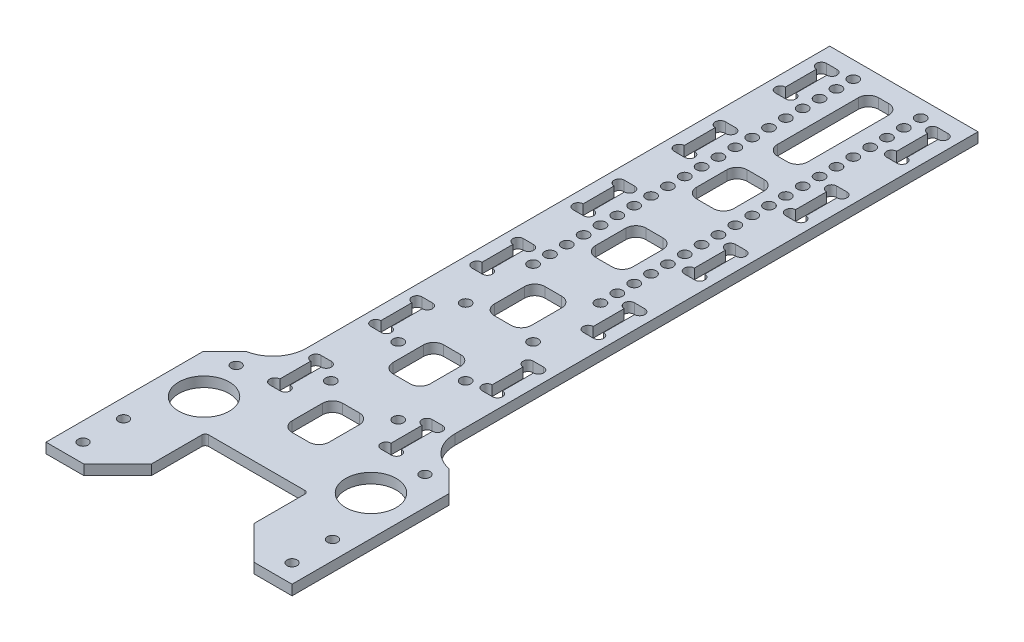
from build123d import *

# Parameters (mm, degrees)
SKETCH_1_W          = 80
SKETCH_1_H          = 225
EXTRUDE_1_DEPTH     = 3
SKETCH_2_W          = 30.5
SKETCH_2_H          = 33
CUT_EXTRUDE_1_DEPTH = 239.817922276
SKETCH_3_W          = 18
SKETCH_3_H          = 165
CUT_EXTRUDE_2_DEPTH = 3
CHAMFER_1_SIZE      = 10
FILLET_1_R          = 10
SKETCH_4_W          = 3.1
SKETCH_4_H          = 15.2
CUT_EXTRUDE_3_DEPTH = 239.817922276
SKETCH_6_R          = 1.55
CUT_EXTRUDE_4_DEPTH = 239.817922276
SKETCH_7_W          = 11
SKETCH_7_H          = 15
SKETCH_7_W_2        = 9
SKETCH_7_H_2        = 30
CUT_EXTRUDE_5_DEPTH = 3
FILLET_2_R          = 3
SKETCH_8_R          = 1.5
CUT_EXTRUDE_6_DEPTH = 45
SKETCH_9_R          = 7.5
CUT_EXTRUDE_7_DEPTH = 239.817922276
CHAMFER_2_SIZE      = 10
SKETCH_10_R         = 1.5
CUT_EXTRUDE_8_DEPTH = 10
SKETCH_12_R         = 1.5
CUT_EXTRUDE_9_DEPTH = 10
FILLET_3_R          = 1


with BuildPart() as part:
    # 草图1 → 凸台-拉伸1 (new body)
    with BuildSketch(Plane(origin=(0, 0, 0), x_dir=(1, 0, 0), z_dir=(0, 1, 0))):
        with Locations((40, 112.5)):
            Rectangle(SKETCH_1_W, SKETCH_1_H)
    extrude(amount=EXTRUDE_1_DEPTH)

    # 草图2 → 切除-拉伸1 (cut, through all)
    with BuildSketch(Plane(origin=(0, 3, 0), x_dir=(1, 0, 0), z_dir=(0, 1, 0))):
        with Locations((40, 16.5)):
            Rectangle(SKETCH_2_W, SKETCH_2_H)
    extrude(amount=-CUT_EXTRUDE_1_DEPTH, mode=Mode.SUBTRACT)

    # 草图3 → 切除-拉伸2 (cut)
    with BuildSketch(Plane.XZ):
        with Locations((71, -142.5)):
            Rectangle(SKETCH_3_W, SKETCH_3_H)
        with Locations((9, -142.5)):
            Rectangle(SKETCH_3_W, SKETCH_3_H)
    extrude(amount=-CUT_EXTRUDE_2_DEPTH, mode=Mode.SUBTRACT)

    # 倒角1
    chamfer_1_edges = [part.edges().sort_by_distance(p)[0] for p in [
        (80, 1.5, -60),
        (0, 1.5, -60),
    ]]
    chamfer(chamfer_1_edges, length=CHAMFER_1_SIZE)

    # 圆角1
    # the kernel refuses this fillet: 10 mm, written as the material it adds along each edge
    with BuildSketch(Plane(origin=(62, 0, -60), x_dir=(0, 0, -1), z_dir=(0, 1, 0))) as fillet_1_piece_1:
        with BuildLine():
            CenterArc((9.797958971, -10), FILLET_1_R, 90, 78.463040967)
            Line((0, -8), (-0.195959179, -7.96))
            ThreePointArc((-0.195959179, -7.96), (-0.2, -4), (-0.2, 0))
            Line((-0.2, 0), (0, 0.2))
            Line((0, 0.2), (9.797958971, 0.2))
            Line((9.797958971, 0.2), (9.797958971, 0))
        make_face()
    extrude(amount=3)
    with BuildSketch(Plane(origin=(18, 0, -60), x_dir=(-1, 0, 0), z_dir=(0, 1, 0))) as fillet_1_piece_2:
        with BuildLine():
            CenterArc((10, -9.797958971), FILLET_1_R, 101.536959033, 78.463040967)
            Line((0, -9.797958971), (-0.2, -9.797958971))
            Line((-0.2, -9.797958971), (-0.2, 0))
            Line((-0.2, 0), (0, 0.2))
            ThreePointArc((0, 0.2), (4, 0.2), (7.96, 0.195959179))
            Line((7.96, 0.195959179), (8, 0))
        make_face()
    extrude(amount=3)

    # 草图4 → 切除-拉伸3 (cut, through all)
    with BuildSketch(Plane(origin=(0, 3, 0), x_dir=(1, 0, 0), z_dir=(0, 1, 0))):
        with Locations((23.5, 212.5)):
            Rectangle(SKETCH_4_W, SKETCH_4_H)
        with Locations((56.5, 212.5)):
            Rectangle(SKETCH_4_W, SKETCH_4_H)
        with Locations((23.5, 182.5)):
            Rectangle(SKETCH_4_W, SKETCH_4_H)
        with Locations((56.5, 182.5)):
            Rectangle(SKETCH_4_W, SKETCH_4_H)
        with Locations((23.5, 152.5)):
            Rectangle(SKETCH_4_W, SKETCH_4_H)
        with Locations((56.5, 152.5)):
            Rectangle(SKETCH_4_W, SKETCH_4_H)
        with Locations((23.5, 122.5)):
            Rectangle(SKETCH_4_W, SKETCH_4_H)
        with Locations((56.5, 122.5)):
            Rectangle(SKETCH_4_W, SKETCH_4_H)
        with Locations((23.5, 92.5)):
            Rectangle(SKETCH_4_W, SKETCH_4_H)
        with Locations((56.5, 92.5)):
            Rectangle(SKETCH_4_W, SKETCH_4_H)
        with Locations((23.5, 62.5)):
            Rectangle(SKETCH_4_W, SKETCH_4_H)
        with Locations((56.5, 62.5)):
            Rectangle(SKETCH_4_W, SKETCH_4_H)
    extrude(amount=-CUT_EXTRUDE_3_DEPTH, mode=Mode.SUBTRACT)

    # 草图6 → 切除-拉伸4 (cut, through all)
    with BuildSketch(Plane(origin=(0, 3, 0), x_dir=(1, 0, 0), z_dir=(0, 1, 0))):
        with Locations(Location((50, 220, 0), (0, 0, 270))):
            Circle(SKETCH_6_R)
        with Locations(Location((30, 220, 0), (0, 0, 90))):
            Circle(SKETCH_6_R)
        with Locations(Location((30, 215, 0), (0, 0, 90))):
            Circle(SKETCH_6_R)
        with Locations(Location((50, 215, 0), (0, 0, 270))):
            Circle(SKETCH_6_R)
        with Locations(Location((30, 210, 0), (0, 0, 90))):
            Circle(SKETCH_6_R)
        with Locations(Location((50, 210, 0), (0, 0, 270))):
            Circle(SKETCH_6_R)
        with Locations(Location((30, 205, 0), (0, 0, 90))):
            Circle(SKETCH_6_R)
        with Locations(Location((50, 205, 0), (0, 0, 270))):
            Circle(SKETCH_6_R)
        with Locations(Location((30, 200, 0), (0, 0, 90))):
            Circle(SKETCH_6_R)
        with Locations(Location((50, 200, 0), (0, 0, 270))):
            Circle(SKETCH_6_R)
        with Locations(Location((30, 195, 0), (0, 0, 90))):
            Circle(SKETCH_6_R)
        with Locations(Location((50, 195, 0), (0, 0, 270))):
            Circle(SKETCH_6_R)
        with Locations(Location((30, 190, 0), (0, 0, 90))):
            Circle(SKETCH_6_R)
        with Locations(Location((50, 190, 0), (0, 0, 270))):
            Circle(SKETCH_6_R)
        with Locations(Location((30, 185, 0), (0, 0, 90))):
            Circle(SKETCH_6_R)
        with Locations(Location((50, 185, 0), (0, 0, 270))):
            Circle(SKETCH_6_R)
        with Locations(Location((30, 180, 0), (0, 0, 90))):
            Circle(SKETCH_6_R)
        with Locations(Location((50, 180, 0), (0, 0, 270))):
            Circle(SKETCH_6_R)
        with Locations(Location((30, 175, 0), (0, 0, 90))):
            Circle(SKETCH_6_R)
        with Locations(Location((50, 175, 0), (0, 0, 270))):
            Circle(SKETCH_6_R)
        with Locations(Location((30, 170, 0), (0, 0, 90))):
            Circle(SKETCH_6_R)
        with Locations(Location((50, 170, 0), (0, 0, 270))):
            Circle(SKETCH_6_R)
        with Locations(Location((30, 165, 0), (0, 0, 90))):
            Circle(SKETCH_6_R)
        with Locations(Location((50, 165, 0), (0, 0, 270))):
            Circle(SKETCH_6_R)
        with Locations(Location((30, 160, 0), (0, 0, 90))):
            Circle(SKETCH_6_R)
        with Locations(Location((50, 160, 0), (0, 0, 270))):
            Circle(SKETCH_6_R)
        with Locations(Location((30, 155, 0), (0, 0, 90))):
            Circle(SKETCH_6_R)
        with Locations(Location((50, 155, 0), (0, 0, 270))):
            Circle(SKETCH_6_R)
        with Locations(Location((30, 150, 0), (0, 0, 90))):
            Circle(SKETCH_6_R)
        with Locations(Location((50, 150, 0), (0, 0, 270))):
            Circle(SKETCH_6_R)
        with Locations(Location((30, 145, 0), (0, 0, 90))):
            Circle(SKETCH_6_R)
        with Locations(Location((50, 145, 0), (0, 0, 270))):
            Circle(SKETCH_6_R)
        with Locations(Location((30, 140, 0), (0, 0, 90))):
            Circle(SKETCH_6_R)
        with Locations(Location((50, 140, 0), (0, 0, 270))):
            Circle(SKETCH_6_R)
        with Locations(Location((30, 135, 0), (0, 0, 90))):
            Circle(SKETCH_6_R)
        with Locations(Location((50, 135, 0), (0, 0, 270))):
            Circle(SKETCH_6_R)
        with Locations(Location((30, 130, 0), (0, 0, 90))):
            Circle(SKETCH_6_R)
        with Locations(Location((50, 130, 0), (0, 0, 270))):
            Circle(SKETCH_6_R)
        with Locations(Location((30, 125, 0), (0, 0, 90))):
            Circle(SKETCH_6_R)
        with Locations(Location((50, 125, 0), (0, 0, 270))):
            Circle(SKETCH_6_R)
        with Locations(Location((30, 105, 0), (0, 0, 90))):
            Circle(SKETCH_6_R)
        with Locations(Location((50, 105, 0), (0, 0, 270))):
            Circle(SKETCH_6_R)
        with Locations(Location((30, 85, 0), (0, 0, 90))):
            Circle(SKETCH_6_R)
        with Locations(Location((50, 85, 0), (0, 0, 270))):
            Circle(SKETCH_6_R)
        with Locations(Location((30, 65, 0), (0, 0, 90))):
            Circle(SKETCH_6_R)
        with Locations(Location((50, 65, 0), (0, 0, 270))):
            Circle(SKETCH_6_R)
    extrude(amount=-CUT_EXTRUDE_4_DEPTH, mode=Mode.SUBTRACT)

    # 草图7 → 切除-拉伸5 (cut)
    with BuildSketch(Plane(origin=(0, 3, 0), x_dir=(1, 0, 0), z_dir=(0, 1, 0))):
        with Locations((40, 143.5)):
            Rectangle(SKETCH_7_W, SKETCH_7_H)
        with Locations((40, 204)):
            Rectangle(SKETCH_7_W_2, SKETCH_7_H_2)
        with Locations((40, 173.5)):
            Rectangle(SKETCH_7_W, SKETCH_7_H)
        with Locations((40, 113.5)):
            Rectangle(SKETCH_7_W, SKETCH_7_H)
        with Locations((40, 83.5)):
            Rectangle(SKETCH_7_W, SKETCH_7_H)
        with Locations((40, 53.5)):
            Rectangle(SKETCH_7_W, SKETCH_7_H)
    extrude(amount=-CUT_EXTRUDE_5_DEPTH, mode=Mode.SUBTRACT)

    # 圆角2
    fillet_2_edges = [part.edges().sort_by_distance(p)[0] for p in [
        (44.5, 1.5, -219),
        (44.5, 1.5, -189),
        (35.5, 1.5, -189),
        (35.5, 1.5, -219),
        (45.5, 1.5, -181),
        (45.5, 1.5, -166),
        (34.5, 1.5, -166),
        (34.5, 1.5, -181),
        (34.5, 1.5, -151),
        (45.5, 1.5, -151),
        (45.5, 1.5, -136),
        (34.5, 1.5, -136),
        (34.5, 1.5, -121),
        (45.5, 1.5, -121),
        (45.5, 1.5, -106),
        (34.5, 1.5, -106),
        (34.5, 1.5, -91),
        (45.5, 1.5, -91),
        (45.5, 1.5, -76),
        (34.5, 1.5, -76),
        (34.5, 1.5, -61),
        (45.5, 1.5, -61),
        (45.5, 1.5, -46),
        (34.5, 1.5, -46),
    ]]
    fillet(fillet_2_edges, radius=FILLET_2_R)

    # 草图8 → 切除-拉伸6 (cut, symmetric)
    with BuildSketch(Plane(origin=(-19.282070169, -20, 1.5), x_dir=(-1, 0, 0), z_dir=(0, -1, 0))):
        with Locations(Location((-28.282070169, 14, 0), (0, 0, 180))):
            Circle(SKETCH_8_R)
        with Locations(Location((-90.282070169, 14, 0), (0, 0, 180))):
            Circle(SKETCH_8_R)
        with Locations(Location((-90.282070169, 26, 0), (0, 0, 180))):
            Circle(SKETCH_8_R)
        with Locations(Location((-28.282070169, 26, 0), (0, 0, 180))):
            Circle(SKETCH_8_R)
    extrude(amount=CUT_EXTRUDE_6_DEPTH, both=True, mode=Mode.SUBTRACT)

    # 草图9 → 切除-拉伸7 (cut, through all)
    with BuildSketch(Plane(origin=(0, 3, 0), x_dir=(1, 0, 0), z_dir=(0, 1, 0))):
        with Locations(Location((15.237711726, 42.145319488, 0), (0, 0, 270))):
            Circle(SKETCH_9_R)
        with Locations(Location((64.762288274, 42.145319488, 0), (0, 0, 90))):
            Circle(SKETCH_9_R)
        Polygon((0, 0), (3.5, 0), (76.5, 0), (80, 0), (80, 64.872237342), (76.5, 64.872237342), (76.5, 7), (3.5, 7), (3.5, 64.872237342), (0, 64.872237342), align=None)
    extrude(amount=-CUT_EXTRUDE_7_DEPTH, mode=Mode.SUBTRACT)

    # 倒角2
    chamfer_2_edges = [part.edges().sort_by_distance(p)[0] for p in [
        (55.25, 1.5, -7),
        (24.75, 1.5, -7),
    ]]
    chamfer(chamfer_2_edges, length=CHAMFER_2_SIZE)

    # 草图10 → 切除-拉伸8 (cut)
    with BuildSketch(Plane(origin=(0, 3, 0), x_dir=(1, 0, 0), z_dir=(0, 1, 0))):
        with Locations((21.95, 218.6)):
            Circle(SKETCH_10_R)
        with Locations((21.95, 206.4)):
            Circle(SKETCH_10_R)
        with Locations((21.95, 188.6)):
            Circle(SKETCH_10_R)
        with Locations((21.95, 176.4)):
            Circle(SKETCH_10_R)
        with Locations((21.95, 158.6)):
            Circle(SKETCH_10_R)
        with Locations((21.95, 146.4)):
            Circle(SKETCH_10_R)
        with Locations((21.95, 128.6)):
            Circle(SKETCH_10_R)
        with Locations((21.95, 116.4)):
            Circle(SKETCH_10_R)
        with Locations((21.95, 98.6)):
            Circle(SKETCH_10_R)
        with Locations((21.95, 86.4)):
            Circle(SKETCH_10_R)
        with Locations((21.95, 68.6)):
            Circle(SKETCH_10_R)
        with Locations((21.95, 56.4)):
            Circle(SKETCH_10_R)
        with Locations((25.05, 56.4)):
            Circle(SKETCH_10_R)
        with Locations((25.05, 68.6)):
            Circle(SKETCH_10_R)
        with Locations((25.05, 86.4)):
            Circle(SKETCH_10_R)
        with Locations((25.05, 98.6)):
            Circle(SKETCH_10_R)
        with Locations((25.05, 116.4)):
            Circle(SKETCH_10_R)
        with Locations((25.05, 128.6)):
            Circle(SKETCH_10_R)
        with Locations((25.05, 146.4)):
            Circle(SKETCH_10_R)
        with Locations((25.05, 158.6)):
            Circle(SKETCH_10_R)
        with Locations((25.05, 176.4)):
            Circle(SKETCH_10_R)
        with Locations((25.05, 188.6)):
            Circle(SKETCH_10_R)
        with Locations((25.05, 206.4)):
            Circle(SKETCH_10_R)
        with Locations((25.05, 218.6)):
            Circle(SKETCH_10_R)
        with Locations((54.95, 98.6)):
            Circle(SKETCH_10_R)
        with Locations((54.95, 86.4)):
            Circle(SKETCH_10_R)
        with Locations((54.95, 68.6)):
            Circle(SKETCH_10_R)
        with Locations((54.95, 56.4)):
            Circle(SKETCH_10_R)
        with Locations((58.05, 56.4)):
            Circle(SKETCH_10_R)
        with Locations((58.05, 68.6)):
            Circle(SKETCH_10_R)
        with Locations((58.05, 86.4)):
            Circle(SKETCH_10_R)
        with Locations((58.05, 98.6)):
            Circle(SKETCH_10_R)
        with Locations((58.05, 116.4)):
            Circle(SKETCH_10_R)
        with Locations((54.95, 116.4)):
            Circle(SKETCH_10_R)
        with Locations((54.95, 128.6)):
            Circle(SKETCH_10_R)
        with Locations((58.05, 128.6)):
            Circle(SKETCH_10_R)
        with Locations((54.95, 146.4)):
            Circle(SKETCH_10_R)
        with Locations((58.05, 146.4)):
            Circle(SKETCH_10_R)
        with Locations((54.95, 158.6)):
            Circle(SKETCH_10_R)
        with Locations((58.05, 158.6)):
            Circle(SKETCH_10_R)
        with Locations((58.05, 176.4)):
            Circle(SKETCH_10_R)
        with Locations((54.95, 176.4)):
            Circle(SKETCH_10_R)
        with Locations((54.95, 188.6)):
            Circle(SKETCH_10_R)
        with Locations((58.05, 188.6)):
            Circle(SKETCH_10_R)
        with Locations((54.95, 206.4)):
            Circle(SKETCH_10_R)
        with Locations((58.05, 206.4)):
            Circle(SKETCH_10_R)
        with Locations((58.05, 218.6)):
            Circle(SKETCH_10_R)
        with Locations((54.95, 218.6)):
            Circle(SKETCH_10_R)
    extrude(amount=-CUT_EXTRUDE_8_DEPTH, mode=Mode.SUBTRACT)

    # 草图12 → 切除-拉伸9 (cut)
    with BuildSketch(Plane(origin=(0, 3, 0), x_dir=(1, 0, 0), z_dir=(0, 1, 0))):
        with Locations(Location((12, 54.928932188, 0), (0, 0, 270))):
            Circle(SKETCH_12_R)
        with Locations(Location((68, 54.928932188, 0), (0, 0, 270))):
            Circle(SKETCH_12_R)
    extrude(amount=-CUT_EXTRUDE_9_DEPTH, mode=Mode.SUBTRACT)

    # 圆角3
    fillet_3_edges = [part.edges().sort_by_distance(p)[0] for p in [
        (24.75, 1.5, -33),
        (55.25, 1.5, -33),
    ]]
    fillet(fillet_3_edges, radius=FILLET_3_R)


solid = part.part
